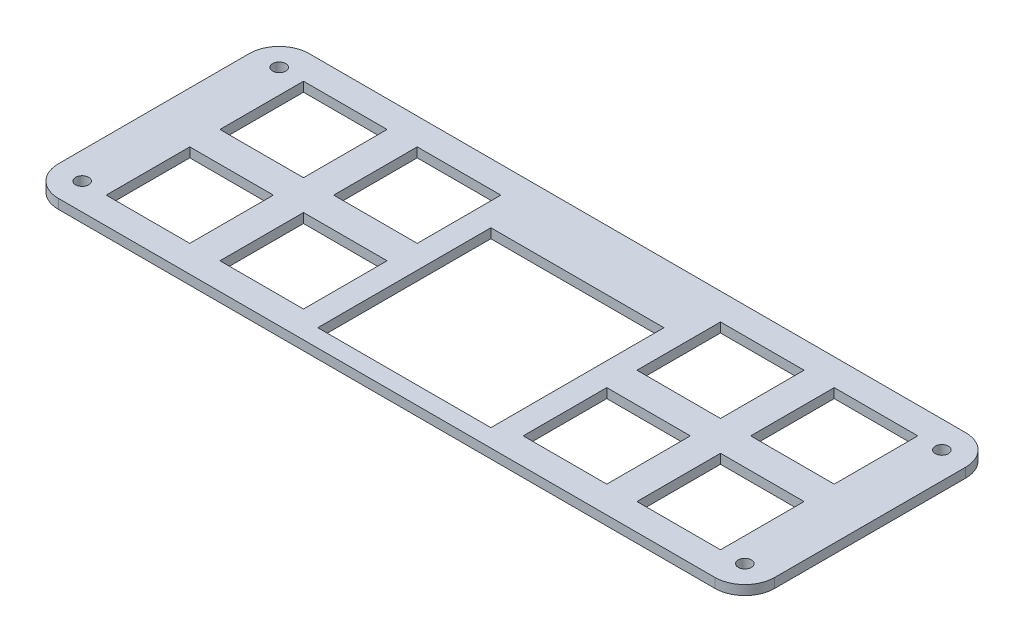
from build123d import *

# Parameters (mm, degrees)
AUFSATZ_LINEAR_AUSTRAGEN1_DEPTH = 1.6
SKIZZE2_W                       = 14
SKIZZE2_H                       = 14
SCHNITT_LINEAR_AUSTRAGEN1_DEPTH = 64.588992758
SKIZZE3_W                       = 29
SKIZZE3_H                       = 29
SCHNITT_LINEAR_AUSTRAGEN2_DEPTH = 64.588992758
SKIZZE4_R                       = 1.1
SCHNITT_LINEAR_AUSTRAGEN3_DEPTH = 64.588992758


with BuildPart() as part:
    # Skizze1 → Aufsatz-Linear austragen1 (new body)
    with BuildSketch(Plane(origin=(0, 0, 0), x_dir=(1, 0, 0), z_dir=(0, 1, 0))):
        with BuildLine():
            Line((-55, 21), (55, 21))
            ThreePointArc((55, 21), (58.535533906, 19.535533906), (60, 16))
            Line((60, 16), (60, -16))
            ThreePointArc((60, -16), (58.535533906, -19.535533906), (55, -21))
            Line((55, -21), (-55, -21))
            ThreePointArc((-55, -21), (-58.535533906, -19.535533906), (-60, -16))
            Line((-60, -16), (-60, 16))
            ThreePointArc((-60, 16), (-58.535533906, 19.535533906), (-55, 21))
        make_face()
    extrude(amount=AUFSATZ_LINEAR_AUSTRAGEN1_DEPTH)

    # Skizze2 → Schnitt-Linear austragen1 (cut, through all)
    with BuildSketch(Plane(origin=(0, 1.6, 0), x_dir=(1, 0, 0), z_dir=(0, 1, 0))):
        with Locations((-44.45, 9.525)):
            Rectangle(SKIZZE2_W, SKIZZE2_H)
        with Locations((-44.45, -9.525)):
            Rectangle(SKIZZE2_W, SKIZZE2_H)
        with Locations((-25.4, 9.525)):
            Rectangle(SKIZZE2_W, SKIZZE2_H)
        with Locations((-25.4, -9.525)):
            Rectangle(SKIZZE2_W, SKIZZE2_H)
        with Locations((25.4, 9.525)):
            Rectangle(SKIZZE2_W, SKIZZE2_H)
        with Locations((25.4, -9.525)):
            Rectangle(SKIZZE2_W, SKIZZE2_H)
        with Locations((44.45, 9.525)):
            Rectangle(SKIZZE2_W, SKIZZE2_H)
        with Locations((44.45, -9.525)):
            Rectangle(SKIZZE2_W, SKIZZE2_H)
    extrude(amount=-SCHNITT_LINEAR_AUSTRAGEN1_DEPTH, mode=Mode.SUBTRACT)

    # Skizze3 → Schnitt-Linear austragen2 (cut, through all)
    with BuildSketch(Plane(origin=(0, 1.6, 0), x_dir=(1, 0, 0), z_dir=(0, 1, 0))):
        with Locations((0, -3.54)):
            Rectangle(SKIZZE3_W, SKIZZE3_H)
    extrude(amount=-SCHNITT_LINEAR_AUSTRAGEN2_DEPTH, mode=Mode.SUBTRACT)

    # Skizze4 → Schnitt-Linear austragen3 (cut, through all)
    with BuildSketch(Plane(origin=(0, 1.6, 0), x_dir=(1, 0, 0), z_dir=(0, 1, 0))):
        with Locations((-55.5, 16.5)):
            Circle(SKIZZE4_R)
        with Locations((-55.5, -16.5)):
            Circle(SKIZZE4_R)
        with Locations((55.5, 16.5)):
            Circle(SKIZZE4_R)
        with Locations((55.5, -16.5)):
            Circle(SKIZZE4_R)
    extrude(amount=-SCHNITT_LINEAR_AUSTRAGEN3_DEPTH, mode=Mode.SUBTRACT)


solid = part.part
